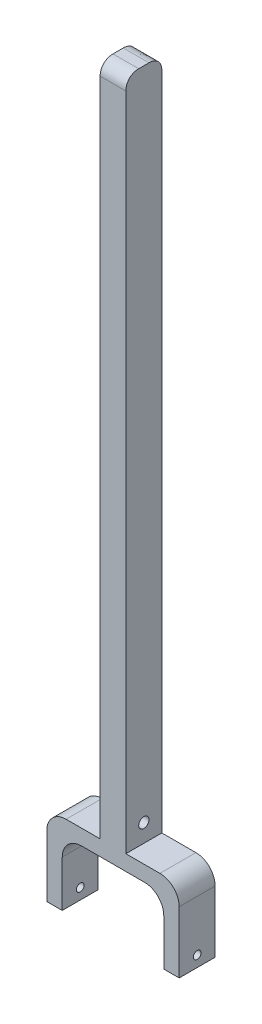
from build123d import *

# Parameters (mm, degrees)
BOSS_EXTRU_1_DEPTH      = 28
ESQUISSE2_R             = 3
ENL_V_MAT_EXTRU_1_DEPTH = 124.943535531
ESQUISSE3_W             = 20
ESQUISSE3_H             = 28
BOSS_EXTRU_2_DEPTH      = 524
CONG_1_SIZE             = 10
ESQUISSE4_R             = 4
ENL_V_MAT_EXTRU_2_DEPTH = 591.876679285


with BuildPart() as part:
    # Esquisse1 → Boss.-Extru.1 (new body)
    with BuildSketch(Plane.XY):
        with BuildLine():
            Line((27, 51), (51.5, 51))
            Line((51.5, 51), (51.5, 63))
            Line((51.5, 63), (15, 63))
            ThreePointArc((15, 63), (4.393398282, 58.606601718), (0, 48))
            Line((0, 48), (0, 0))
            Line((0, 0), (12, 0))
            Line((12, 0), (12, 36))
            ThreePointArc((12, 36), (16.393398282, 46.606601718), (27, 51))
        make_face()
        with BuildLine():
            Line((51.5, 63), (51.5, 51))
            Line((51.5, 51), (76, 51))
            ThreePointArc((76, 51), (86.606601718, 46.606601718), (91, 36))
            Line((91, 36), (91, 0))
            Line((91, 0), (103, 0))
            Line((103, 0), (103, 48))
            ThreePointArc((103, 48), (98.606601718, 58.606601718), (88, 63))
            Line((88, 63), (51.5, 63))
        make_face()
    extrude(amount=BOSS_EXTRU_1_DEPTH)

    # Esquisse2 → Enlèv. mat.-Extru.1 (cut, through all)
    with BuildSketch(Plane(origin=(103, 0, 0), x_dir=(0, 0, -1), z_dir=(1, 0, 0))):
        with Locations((-14, 8.5)):
            Circle(ESQUISSE2_R)
    extrude(amount=-ENL_V_MAT_EXTRU_1_DEPTH, mode=Mode.SUBTRACT)

    # Esquisse3 → Boss.-Extru.2 (add)
    with BuildSketch(Plane(origin=(0, 63, 0), x_dir=(1, 0, 0), z_dir=(0, 1, 0))):
        with Locations((51.5, -14)):
            Rectangle(ESQUISSE3_W, ESQUISSE3_H)
    extrude(amount=BOSS_EXTRU_2_DEPTH)

    # Congé1
    # a fillet whose section is not a circle: 10 mm, written as the material it takes off along each edge
    with BuildSketch(Plane(origin=(16.5, 587, 0), x_dir=(0, -1, 0), z_dir=(1, 0, 0)), Plane(origin=(86.5, 587, 28), x_dir=(0, -1, 0), z_dir=(-1, 0, 0))) as cong_1_piece_1:
        with BuildLine():
            Bezier((CONG_1_SIZE, 0), (0, 0), (0, -CONG_1_SIZE), weights=[1, 0.785674201, 1])
            Line((0, -CONG_1_SIZE), (0, 0))
            Line((0, 0), (CONG_1_SIZE, 0))
        make_face()
    extrude(amount=70, mode=Mode.SUBTRACT)

    # Esquisse4 → Enlèv. mat.-Extru.2 (cut, through all)
    with BuildSketch(Plane.ZY.offset(-41.5)):
        with Locations((14, 77)):
            Circle(ESQUISSE4_R)
    extrude(amount=-ENL_V_MAT_EXTRU_2_DEPTH, mode=Mode.SUBTRACT)


solid = part.part
